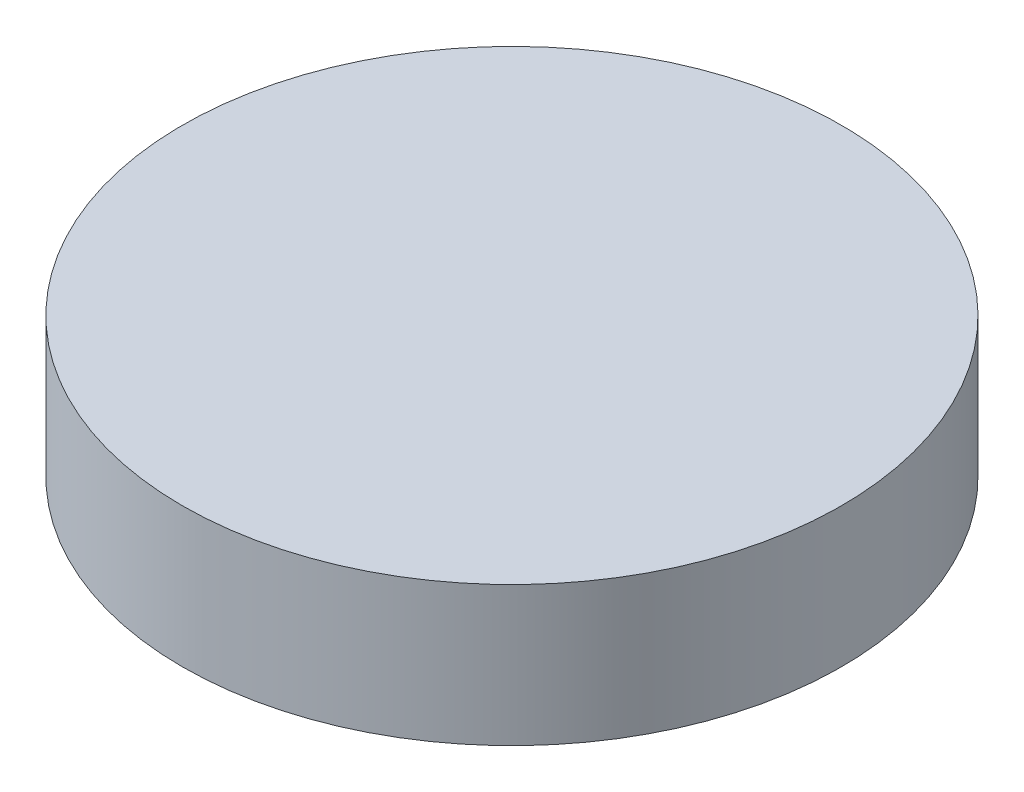
from build123d import *

# Parameters (mm, degrees)
SKETCH1_R           = 3
BOSS_EXTRUDE1_DEPTH = 1.27


with BuildPart() as part:
    # Sketch1 → Boss-Extrude1 (new body)
    with BuildSketch(Plane(origin=(0, 0, 0), x_dir=(1, 0, 0), z_dir=(0, 1, 0))):
        Circle(SKETCH1_R)
    extrude(amount=BOSS_EXTRUDE1_DEPTH)


solid = part.part
